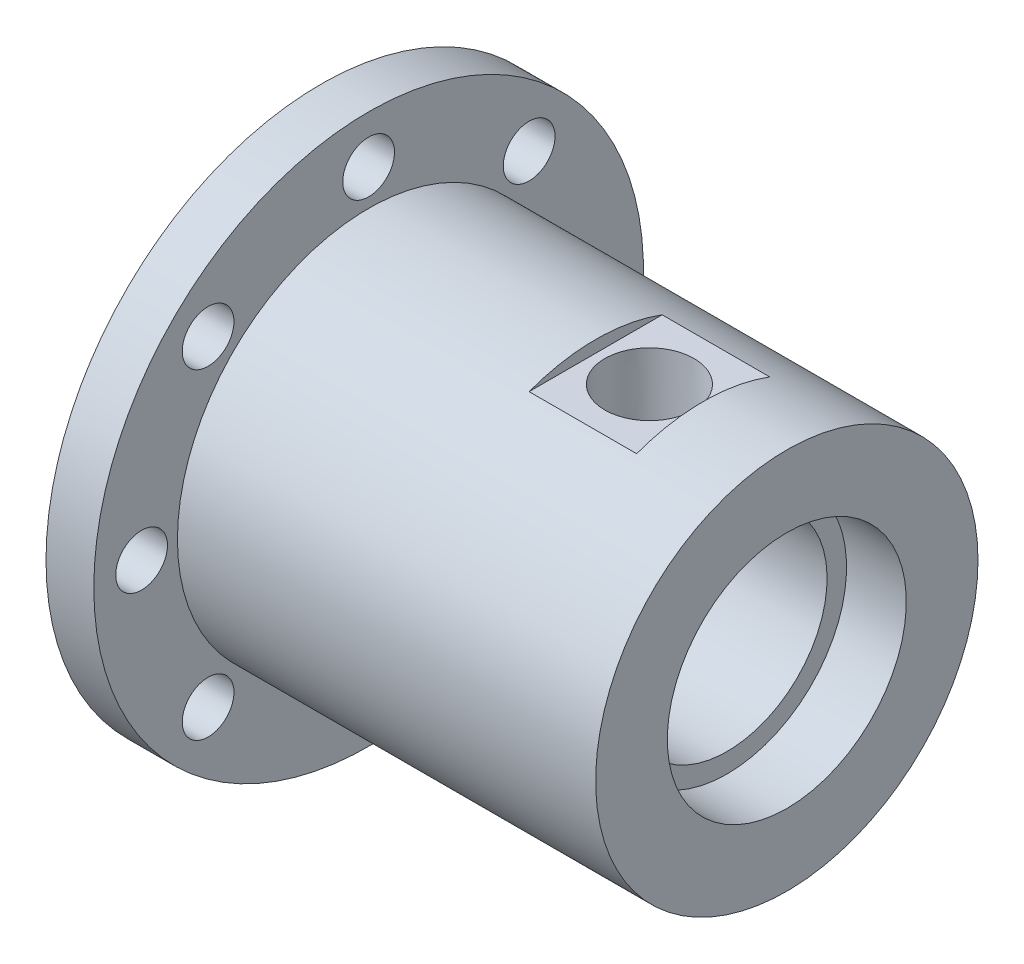
from build123d import *

# Parameters (mm, degrees)
SKETCH2_R                = 20.32
BOSS_EXTRUDE1_DEPTH      = 49.53
SKETCH3_R                = 29.21
SKETCH3_R_2              = 19.05
BOSS_EXTRUDE2_DEPTH      = 5.08
M5_CLEARANCE_HOLE1_D     = 5.5
M5_CLEARANCE_HOLE1_DEPTH = 5.08
SKETCH6_W                = 11.43
SKETCH6_H                = 25.4
CUT_EXTRUDE1_DEPTH       = 1.27
SKETCH9_R                = 16.7132
SKETCH9_R_2              = 14.1478
CUT_EXTRUDE2_DEPTH       = 1.27


# Read off the part's stored shape, not the designer's step: 1/8 NPT Tapped Hole1
with BuildPart() as part:
    # Sketch2 → Boss-Extrude1 (new body)
    with BuildSketch(Plane(origin=(0, 0, 0), x_dir=(0, 0, -1), z_dir=(1, 0, 0))):
        Circle(SKETCH2_R)
    extrude(amount=-BOSS_EXTRUDE1_DEPTH)

    # Sketch1 → Cut-Revolve1 (revolve, cut)
    with BuildSketch(Plane.XY):
        Polygon((-30.6578, 10.6299), (-30.6578, 11.9507), (-33.02, 11.9507), (-33.02, 10.6299), (-34.29, 10.6299), (-34.29, 12.7), (-49.53, 12.7), (-49.53, 0), (0, 0), (0, 12.7), (-6.35, 12.7), (-6.35, 10.6299), (-26.5176, 10.6299), (-26.5176, 11.9507), (-28.8798, 11.9507), (-28.8798, 10.6299), align=None)
    revolve(axis=Axis((0, 0, 0), (-1, 0, 0)), mode=Mode.SUBTRACT)

    # Sketch3 → Boss-Extrude2 (add)
    with BuildSketch(Plane.ZY.offset(49.53)):
        Circle(SKETCH3_R)
        Circle(SKETCH3_R_2, mode=Mode.SUBTRACT)
    extrude(amount=-BOSS_EXTRUDE2_DEPTH)

    # M5 Clearance Hole1
    with Locations(Plane(origin=(-44.45, 0, 0), x_dir=(0, 0, -1), z_dir=(1, 0, 0))):
        with Locations((0, 24.13), (0, 0), (17.06248663, 17.06248663), (24.13, 0), (17.06248663, -17.06248663), (0, -24.13), (-17.06248663, -17.06248663), (-24.13, 0), (-17.06248663, 17.06248663)):
            Hole(M5_CLEARANCE_HOLE1_D / 2, depth=M5_CLEARANCE_HOLE1_DEPTH)

    # Sketch6 → Cut-Extrude1 (cut)
    with BuildSketch(Plane(origin=(0, 20.32, 0), x_dir=(1, 0, 0), z_dir=(0, 1, 0))):
        with Locations((-14.605, 0)):
            Rectangle(SKETCH6_W, SKETCH6_H)
    extrude(amount=-CUT_EXTRUDE1_DEPTH, mode=Mode.SUBTRACT)

    # 1/8 NPT Tapped Hole1 outline → 1/8 NPT Tapped Hole1 (revolve, cut)
    with BuildSketch(Plane(origin=(-14.605, 0, 0), x_dir=(1, 0, 0), z_dir=(0, 0, 1))):
        Polygon((0, 9.757655132), (4.2164, 9.757655132), (4.2164, 12.192), (4.537401096, 12.192), (4.7427388, 19.05), (0, 19.05), align=None)
    revolve(axis=Axis((-14.605, 0, 0), (0, 1, 0)), mode=Mode.SUBTRACT)

    # Sketch9 → Cut-Extrude2 (cut)
    with BuildSketch(Plane.ZY.offset(49.53)):
        Circle(SKETCH9_R)
        Circle(SKETCH9_R_2, mode=Mode.SUBTRACT)
    extrude(amount=-CUT_EXTRUDE2_DEPTH, mode=Mode.SUBTRACT)


solid = part.part
